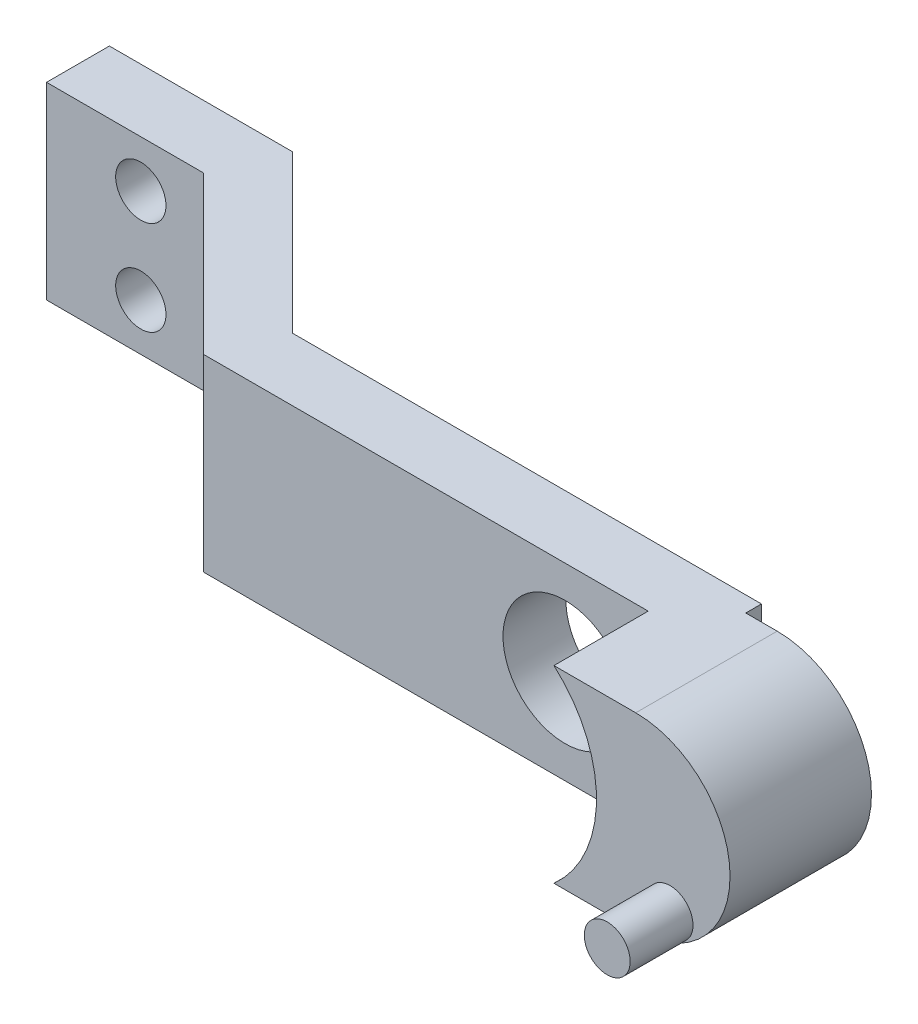
from build123d import *

# Parameters (mm, degrees)
SKETCH1_W           = 39.5
SKETCH1_H           = 12
SKETCH1_R           = 3.95
BOSS_EXTRUDE1_DEPTH = 4
BOSS_EXTRUDE3_DEPTH = 12
SKETCH4_R           = 1.6
CUT_EXTRUDE1_DEPTH  = 45.55333882
FILLET1_R           = 6
BOSS_EXTRUDE5_DEPTH = 6
SKETCH5_R           = 1.46
BOSS_EXTRUDE4_DEPTH = 4
SKETCH6_W           = 8
SKETCH6_H           = 1
CUT_EXTRUDE3_DEPTH  = 47.786750261


with BuildPart() as part:
    # Sketch1 → Boss-Extrude1 (new body)
    with BuildSketch(Plane.XY):
        with Locations((-3.25, 0)):
            Rectangle(SKETCH1_W, SKETCH1_H)
        Circle(SKETCH1_R, mode=Mode.SUBTRACT)
    extrude(amount=BOSS_EXTRUDE1_DEPTH)

    # Sketch3 → Boss-Extrude3 (add)
    with BuildSketch(Plane.XZ.offset(6)):
        Polygon((-23, 4), (-33, -6), (-43, -6), (-43, -10), (-31.343145751, -10), (-21.343145751, 0), align=None)
    extrude(amount=-BOSS_EXTRUDE3_DEPTH)

    # Sketch4 → Cut-Extrude1 (cut, through all)
    with BuildSketch(Plane.XY.offset(-6)):
        with Locations((-37, 3)):
            Circle(SKETCH4_R)
        with Locations((-37, -3)):
            Circle(SKETCH4_R)
    extrude(amount=-CUT_EXTRUDE1_DEPTH, mode=Mode.SUBTRACT)

    # Fillet1
    fillet1_edges = [part.edges().sort_by_distance(p)[0] for p in [
        (16.5, 6, 2),
        (16.5, -6, 2),
    ]]
    fillet(fillet1_edges, radius=FILLET1_R - 0.0001)  # a hair under: the kernel refuses the full size

    # Sketch7 → Boss-Extrude5 (add)
    with BuildSketch(Plane.XY.offset(4)):
        with BuildLine():
            Line((5.291502622, -6), (10.5, -6))
            ThreePointArc((10.5, -6), (16.5, 0), (10.5, 6))
            Line((10.5, 6), (5.291502622, 6))
            ThreePointArc((5.291502622, 6), (8, 0), (5.291502622, -6))
        make_face()
    extrude(amount=BOSS_EXTRUDE5_DEPTH)

    # Sketch5 → Boss-Extrude4 (add)
    with BuildSketch(Plane.XY.offset(10)):
        with Locations(Location((12.683177793, -3.892819016, 0), (0, 0, 180))):
            Circle(SKETCH5_R)
    extrude(amount=BOSS_EXTRUDE4_DEPTH)

    # Sketch6 → Cut-Extrude3 (cut, through all)
    with BuildSketch(Plane.XZ.offset(6)):
        with Locations((12.5, 0.5)):
            Rectangle(SKETCH6_W, SKETCH6_H)
    extrude(amount=-CUT_EXTRUDE3_DEPTH, mode=Mode.SUBTRACT)


solid = part.part
